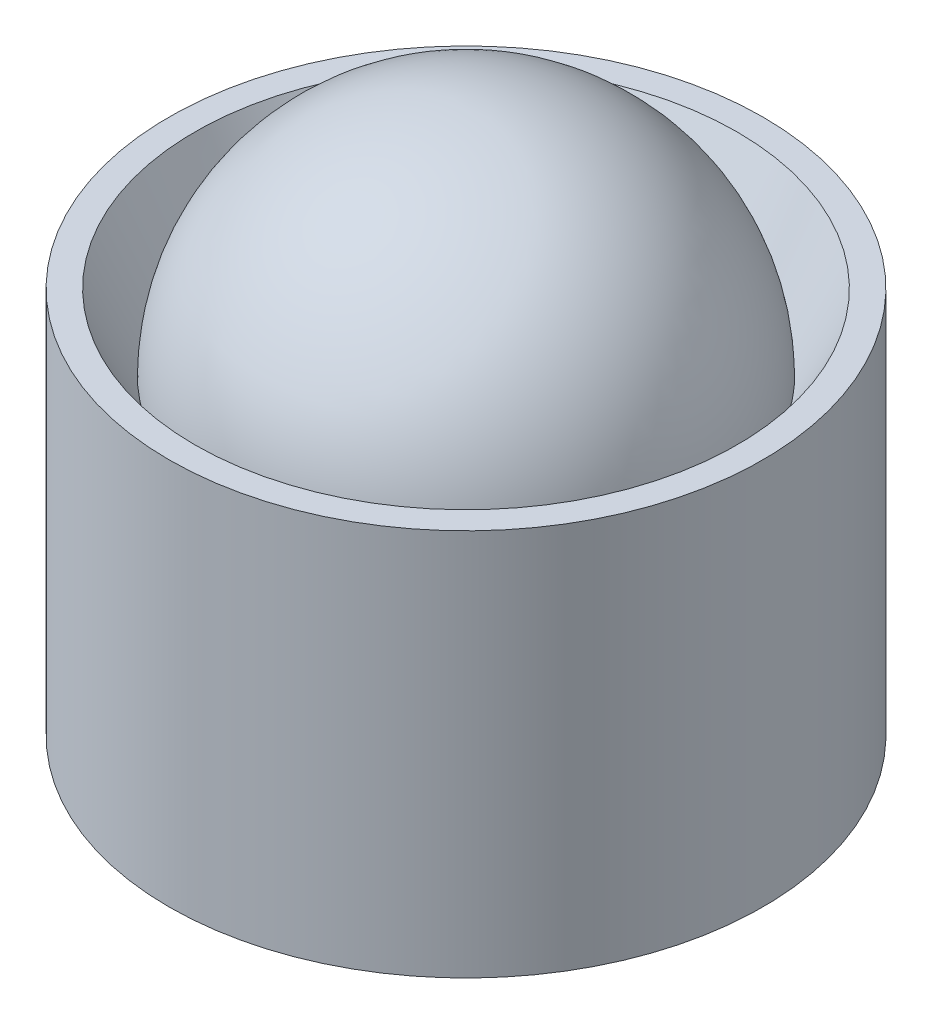
from build123d import *

# Parameters (mm, degrees)
SKETCH1_R           = 11.5
SKETCH1_R_2         = 5.5
SKETCH1_R_3         = 1.25
BOSS_EXTRUDE1_DEPTH = 15
CHAMFER1_SIZE       = 10
CHAMFER1_SIZE_2     = 5
SKETCH2_R           = 9
BOSS_EXTRUDE2_DEPTH = 9
FILLET1_R           = 9


# Some blends are built 0.0001 mm under size
with BuildPart() as part:
    # Sketch1 → Boss-Extrude1 (new body)
    with BuildSketch(Plane(origin=(0, 0, 0), x_dir=(1, 0, 0), z_dir=(0, 1, 0))):
        with Locations(Location((0, 0, 0), (0, 0, 270))):
            Circle(SKETCH1_R)
        with Locations(Location((0, 0, 0), (0, 0, 270))):
            Circle(SKETCH1_R_2, mode=Mode.SUBTRACT)
        with Locations(Location((7.5, 0, 0), (0, 0, 270))):
            Circle(SKETCH1_R_3, mode=Mode.SUBTRACT)
        with Locations(Location((-7.5, 0, 0), (0, 0, 270))):
            Circle(SKETCH1_R_3, mode=Mode.SUBTRACT)
    extrude(amount=BOSS_EXTRUDE1_DEPTH)

    # Chamfer1
    # the kernel refuses this chamfer: 10, 5 mm, written as the material it takes off along each edge
    with BuildSketch(Plane(origin=(0, 15, 0), x_dir=(0, 0, 1), z_dir=(-1, 0, 0))) as chamfer1_piece_1:
        Polygon((5.5, -CHAMFER1_SIZE), (5.5 + CHAMFER1_SIZE_2, 0), (5.5, 0), align=None)
    revolve(axis=Axis((0, 15, 0), (0, 1, 0)), mode=Mode.SUBTRACT)


with BuildPart() as body_2:
    # Sketch2 → Boss-Extrude2 (new, symmetric)
    with BuildSketch(Plane(origin=(0, 12, 0), x_dir=(-1, 0, 0), z_dir=(0, -1, 0))):
        with Locations(Location((0, 0, 0), (0, 0, 90))):
            Circle(SKETCH2_R)
    extrude(amount=BOSS_EXTRUDE2_DEPTH, both=True)

    # Fillet1
    fillet1_edges = [body_2.edges().sort_by_distance(p)[0] for p in [
        (0, 21, 9),
        (0, 3, 9),
    ]]
    fillet(fillet1_edges, radius=FILLET1_R - 0.0001)  # a hair under: the kernel refuses the full size


solid = Compound([part.part, body_2.part])
